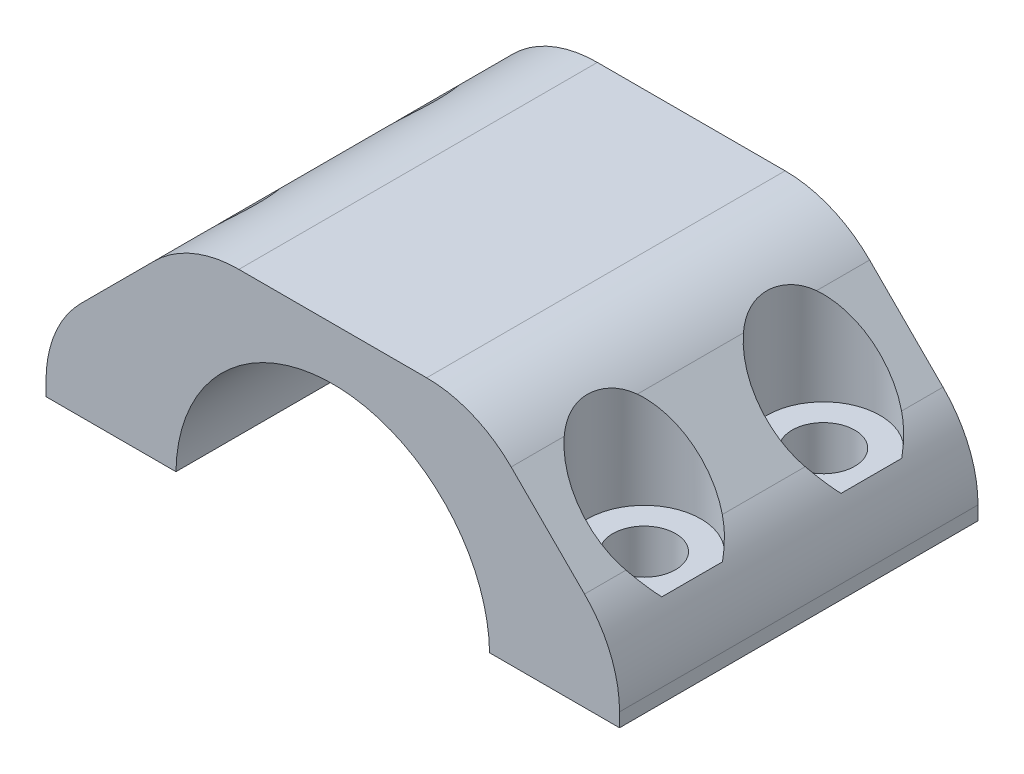
from build123d import *

# Parameters (mm, degrees)
SKETCH1_W              = 48
SKETCH1_H              = 17.5
BODY_DEPTH             = 30
TUBE_CUTOUT_DEPTH      = 40.402569713
SKETCH3_R              = 2.625
CUT_EXTRUDE_M5_DEPTH   = 43.216702856
SLOPE_DEPTH            = 40.402569713
BOLT_HEAD_CUTOUT_START = -6.5
SKETCH5_R              = 4.75
BOLT_HEAD_CUTOUT_DEPTH = 23
FILLET_2_R             = 10
SKETCH7_W              = 48
SKETCH7_H              = 30
CLEARANCE_DEPTH        = 0.2


with BuildPart() as part:
    # Sketch1 → body (new body)
    with BuildSketch(Plane.XY):
        Rectangle(SKETCH1_W, SKETCH1_H)
    extrude(amount=BODY_DEPTH)

    # Sketch2 → tube_cutout (cut, through all)
    with BuildSketch(Plane.XY):
        with BuildLine():
            Line((13.125, -8.75), (-13.125, -8.75))
            ThreePointArc((-13.125, -8.75), (0, 4.375), (13.125, -8.75))
        make_face()
    extrude(amount=TUBE_CUTOUT_DEPTH, mode=Mode.SUBTRACT)

    # Sketch3 → Cut-Extrude M5 (cut, through all)
    with BuildSketch(Plane.XZ.offset(8.75)):
        with Locations(Location((18.5625, 22.5, 0), (0, 0, 270))):
            Circle(SKETCH3_R)
        with Locations(Location((18.5625, 7.5, 0), (0, 0, 270))):
            Circle(SKETCH3_R)
        with Locations(Location((-18.5625, 7.5, 0), (0, 0, 90))):
            Circle(SKETCH3_R)
        with Locations(Location((-18.5625, 22.5, 0), (0, 0, 90))):
            Circle(SKETCH3_R)
    extrude(amount=-CUT_EXTRUDE_M5_DEPTH, mode=Mode.SUBTRACT)

    # Sketch4 → slope (cut, through all)
    with BuildSketch(Plane.XY):
        Polygon((-24, 8.75), (-24, -3.25), (-12, 8.75), align=None)
        Polygon((24, -3.25), (12, 8.75), (24, 8.75), align=None)
    extrude(amount=SLOPE_DEPTH, mode=Mode.SUBTRACT)

    # Sketch5 → bolt_head_cutout (cut)
    with BuildSketch(Plane.XZ.offset(8.75).offset(BOLT_HEAD_CUTOUT_START)):
        with Locations((18.5625, 22.5)):
            Circle(SKETCH5_R)
        with Locations((18.5625, 7.5)):
            Circle(SKETCH5_R)
        with Locations((-18.5625, 7.5)):
            Circle(SKETCH5_R)
        with Locations((-18.5625, 22.5)):
            Circle(SKETCH5_R)
    extrude(amount=-BOLT_HEAD_CUTOUT_DEPTH, mode=Mode.SUBTRACT)

    # fillet 2
    # the kernel refuses this fillet: 10 mm, written as the material it takes off along each edge
    with BuildSketch(Plane(origin=(24, -3.25, -10.355339059), x_dir=(-0.7071067811865475, 0.7071067811865478, 0), z_dir=(0, 0, 1)), Plane(origin=(12, 8.75, -10.355339059), x_dir=(-1, 0, 0), z_dir=(0, 0, 1)), Plane(origin=(-12, 8.75, -10.355339059), x_dir=(-0.7071067811865474, -0.7071067811865478, 0), z_dir=(0, 0, 1))) as fillet_2_piece_1:
        with BuildLine():
            CenterArc((FILLET_2_R * 0.414213562373, FILLET_2_R), FILLET_2_R, 225, 45)
            Line((-FILLET_2_R * 0.292893218813, FILLET_2_R * 0.292893218813), (0, 0))
            Line((0, 0), (FILLET_2_R * 0.414213562373, 0))
        make_face()
    extrude(amount=50.710678119, mode=Mode.SUBTRACT)
    with BuildSketch(Plane(origin=(-24, -3.25, -10.355339059), x_dir=(0.7071067811865469, 0.707106781186548, 0), z_dir=(0, 0, 1))) as fillet_2_piece_2:
        with BuildLine():
            CenterArc((FILLET_2_R * 0.414213562373, -FILLET_2_R), FILLET_2_R, 90, 45)
            Line((-FILLET_2_R * 0.292893218813, -FILLET_2_R * 0.292893218813), (0, 0))
            Line((0, 0), (FILLET_2_R * 0.414213562373, 0))
        make_face()
    extrude(amount=50.710678119, mode=Mode.SUBTRACT)

    # Sketch7 → clearance (cut)
    with BuildSketch(Plane.XZ.offset(8.75)):
        with Locations((0, 15)):
            Rectangle(SKETCH7_W, SKETCH7_H)
    extrude(amount=-CLEARANCE_DEPTH, mode=Mode.SUBTRACT)


solid = part.part
